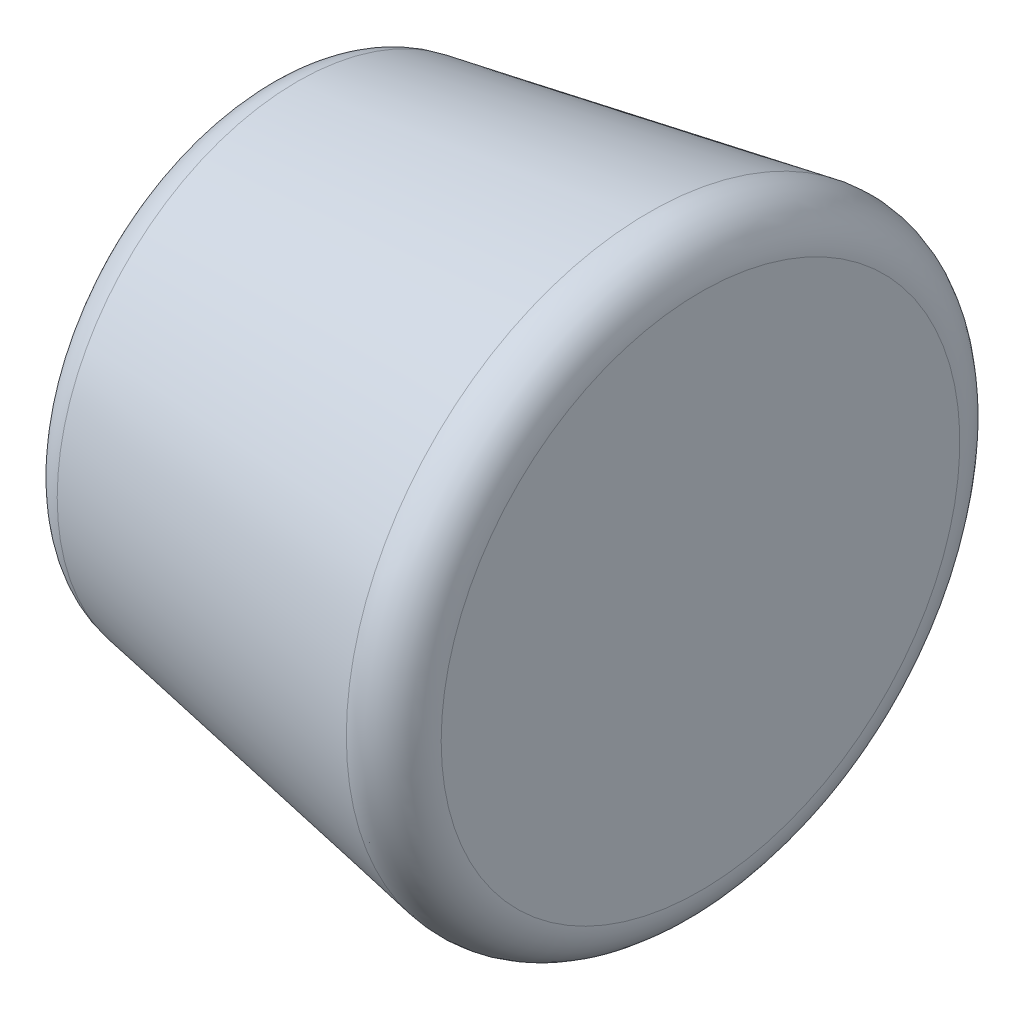
from build123d import *

# Parameters (mm, degrees)
FILLET1_R = 1


with BuildPart() as part:
    # Sketch1 → Revolve1 (revolve)
    with BuildSketch(Plane.XY):
        Polygon((0, 5.323), (0, 0), (10, 0), (10, 7.096), align=None)
    revolve(axis=Axis((10, 0, 0), (-1, 0, 0)))

    # Fillet1
    fillet1_edges = [part.edges().sort_by_distance(p)[0] for p in [
        (0, -5.323, 0),
        (10, -7.096, 0),
    ]]
    fillet(fillet1_edges, radius=FILLET1_R)


solid = part.part
